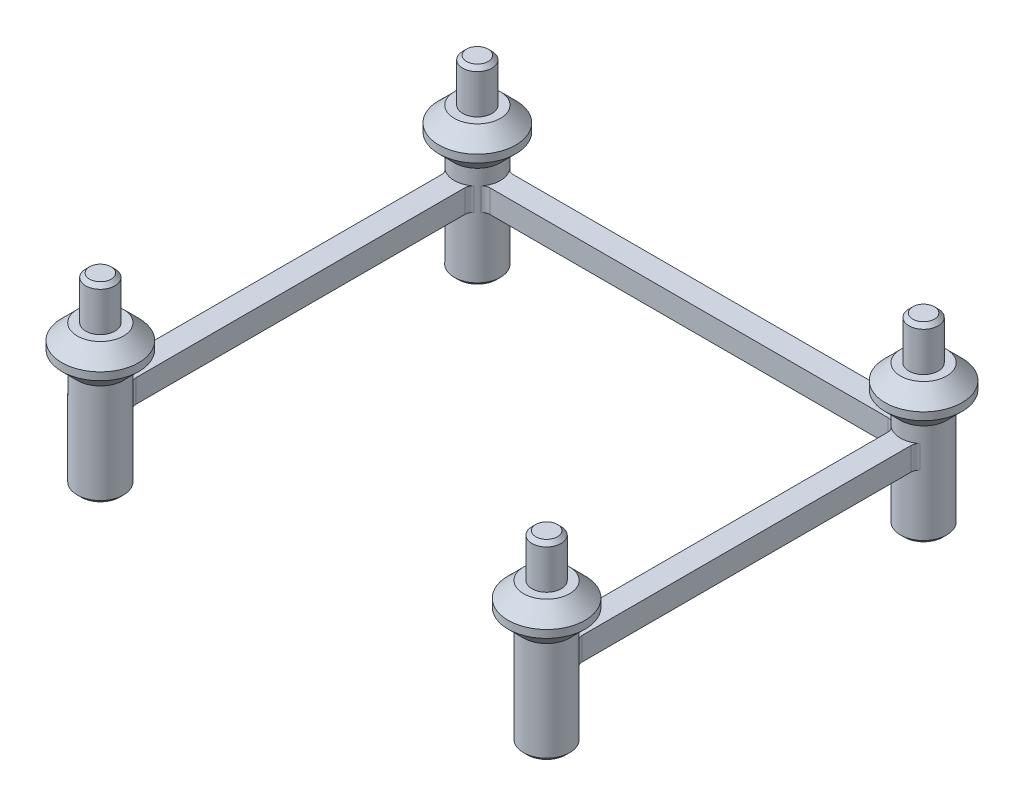
from build123d import *

# Parameters (mm, degrees)
SKETCH_1_R          = 3
EXTRUDE_1_DEPTH     = 18.4
EXTRUDE_1_2_DEPTH   = 18.4
EXTRUDE_1_3_DEPTH   = 18.4
EXTRUDE_1_4_DEPTH   = 18.4
SKETCH_2_R          = 1.45
CUT_EXTRUDE_1_DEPTH = 5
SKETCH_3_R          = 5
EXTRUDE_2_DEPTH     = 3
EXTRUDE_START       = -7
EXTRUDE_3_DEPTH     = 3
CHAMFER_1_SIZE      = 0.5
SKETCH_5_R          = 1.9
EXTRUDE_4_DEPTH     = 5.6
CHAMFER_2_SIZE      = 0.5
CHAMFER_3_SIZE      = 2
FILLET_1_R          = 1


with BuildPart() as part:
    # 스케치1 → 보스-돌출1 (new body)
    with BuildSketch(Plane(origin=(0, 0, 0), x_dir=(1, 0, 0), z_dir=(0, 1, 0))):
        with Locations(Location((-29, 24.5, 0), (0, 0, 270))):
            Circle(SKETCH_1_R)
    extrude(amount=EXTRUDE_1_DEPTH)


with BuildPart() as body_2:
    # 스케치1 → Extrude 1 2 (new body)
    with BuildSketch(Plane(origin=(0, 0, 0), x_dir=(1, 0, 0), z_dir=(0, 1, 0))):
        with Locations(Location((29, 24.5, 0), (0, 0, 90))):
            Circle(SKETCH_1_R)
    extrude(amount=EXTRUDE_1_2_DEPTH)


with BuildPart() as body_3:
    # 스케치1 → Extrude 1 3 (new body)
    with BuildSketch(Plane(origin=(0, 0, 0), x_dir=(1, 0, 0), z_dir=(0, 1, 0))):
        with Locations(Location((-29, -24.5, 0), (0, 0, 90))):
            Circle(SKETCH_1_R)
    extrude(amount=EXTRUDE_1_3_DEPTH)


with BuildPart() as body_4:
    # 스케치1 → Extrude 1 4 (new body)
    with BuildSketch(Plane(origin=(0, 0, 0), x_dir=(1, 0, 0), z_dir=(0, 1, 0))):
        with Locations(Location((29, -24.5, 0), (0, 0, 270))):
            Circle(SKETCH_1_R)
    extrude(amount=EXTRUDE_1_4_DEPTH)


with BuildPart() as cut_extrude_1_tool:
    # 스케치2 → 컷-돌출1 (new body)
    with BuildSketch(Plane.XZ):
        with Locations(Location((-29, 24.5, 0), (0, 0, 270))):
            Circle(SKETCH_2_R)
        with Locations(Location((29, 24.5, 0), (0, 0, 270))):
            Circle(SKETCH_2_R)
        with Locations(Location((-29, -24.5, 0), (0, 0, 270))):
            Circle(SKETCH_2_R)
        with Locations(Location((29, -24.5, 0), (0, 0, 270))):
            Circle(SKETCH_2_R)
    extrude(amount=-CUT_EXTRUDE_1_DEPTH)


with BuildPart() as part_1:
    add(part.part)

    # 컷-돌출1: cut by cut_extrude_1_tool
    add(cut_extrude_1_tool.part, mode=Mode.SUBTRACT)



with BuildPart() as body_2_1:
    add(body_2.part)

    # 컷-돌출1: cut by cut_extrude_1_tool
    add(cut_extrude_1_tool.part, mode=Mode.SUBTRACT)


with BuildPart() as body_3_1:
    add(body_3.part)

    # 컷-돌출1: cut by cut_extrude_1_tool
    add(cut_extrude_1_tool.part, mode=Mode.SUBTRACT)


with BuildPart() as body_4_1:
    add(body_4.part)

    # 컷-돌출1: cut by cut_extrude_1_tool
    add(cut_extrude_1_tool.part, mode=Mode.SUBTRACT)


with BuildPart() as part_2:
    add(part_1.part)

    add(body_2_1.part)  # 보스-돌출2 merges body 2

    add(body_3_1.part)  # 보스-돌출2 merges body 3

    add(body_4_1.part)  # 보스-돌출2 merges body 4
    # 스케치3 → 보스-돌출2 (add)
    with BuildSketch(Plane(origin=(0, 18.4, 0), x_dir=(1, 0, 0), z_dir=(0, 1, 0))):
        with Locations(Location((29, 24.5, 0), (0, 0, 270))):
            Circle(SKETCH_3_R)
        with Locations(Location((29, -24.5, 0), (0, 0, 270))):
            Circle(SKETCH_3_R)
        with Locations(Location((-29, -24.5, 0), (0, 0, 270))):
            Circle(SKETCH_3_R)
        with Locations(Location((-29, 24.5, 0), (0, 0, 270))):
            Circle(SKETCH_3_R)
    extrude(amount=-EXTRUDE_2_DEPTH)

    # 스케치4 → 보스-돌출3 (add)
    with BuildSketch(Plane(origin=(0, 18.4, 0), x_dir=(1, 0, 0), z_dir=(0, 1, 0)).offset(EXTRUDE_START)):
        Polygon((27.5, 23), (27.5, -23), (27.5, -26), (30.5, -26), (30.5, 26), (-30.5, 26), (-30.5, -26), (-27.5, -26), (-27.5, -23), (-27.5, 23), align=None)
    extrude(amount=-EXTRUDE_3_DEPTH)

    # 모따기1
    chamfer_1_edges = [part_2.edges().sort_by_distance(p)[0] for p in [
        (-29, 0, -23.05),
        (-29, 0, -27.5),
        (29, 0, -21.5),
        (29, 0, -23.05),
        (-29, 0, 27.5),
        (-29, 0, 25.95),
        (29, 0, 21.5),
        (29, 0, 25.95),
    ]]
    chamfer(chamfer_1_edges, length=CHAMFER_1_SIZE)

    # 스케치5 → 보스-돌출4 (add)
    with BuildSketch(Plane(origin=(0, 18.4, 0), x_dir=(1, 0, 0), z_dir=(0, 1, 0))):
        with Locations(Location((29, 24.5, 0), (0, 0, 270))):
            Circle(SKETCH_5_R)
        with Locations(Location((29, -24.5, 0), (0, 0, 270))):
            Circle(SKETCH_5_R)
        with Locations(Location((-29, -24.5, 0), (0, 0, 270))):
            Circle(SKETCH_5_R)
        with Locations(Location((-29, 24.5, 0), (0, 0, 270))):
            Circle(SKETCH_5_R)
    extrude(amount=EXTRUDE_4_DEPTH)

    # 모따기2
    chamfer_2_edges = [part_2.edges().sort_by_distance(p)[0] for p in [
        (29, 24, -26.4),
        (29, 24, 22.6),
        (-29, 24, 22.6),
        (-29, 24, -26.4),
    ]]
    chamfer(chamfer_2_edges, length=CHAMFER_2_SIZE)

    # 모따기3
    chamfer_3_edges = [part_2.edges().sort_by_distance(p)[0] for p in [
        (-29, 15.4, -27.5),
        (-29, 18.4, -29.5),
        (29, 15.4, -21.5),
        (29, 18.4, -29.5),
        (-29, 15.4, 27.5),
        (-29, 18.4, 19.5),
        (29, 15.4, 21.5),
        (29, 18.4, 19.5),
    ]]
    chamfer(chamfer_3_edges, length=CHAMFER_3_SIZE - 0.0001)  # a hair under: the kernel refuses the full size

    # 필렛1
    fillet_1_edges = [part_2.edges().sort_by_distance(p)[0] for p in [
        (-30.5, 9.9, -21.901923789),
        (-27.5, 9.9, -21.901923789),
        (-26.401923789, 9.9, -26),
        (-26.401923789, 9.9, -23),
        (27.5, 9.9, -21.901923789),
        (26.401923789, 9.9, -26),
        (26.401923789, 9.9, -23),
        (30.5, 9.9, -21.901923789),
        (-27.5, 9.9, 21.901923789),
        (-30.5, 9.9, 21.901923789),
        (30.5, 9.9, 21.901923789),
        (27.5, 9.9, 21.901923789),
    ]]
    fillet(fillet_1_edges, radius=FILLET_1_R)


solid = part_2.part
